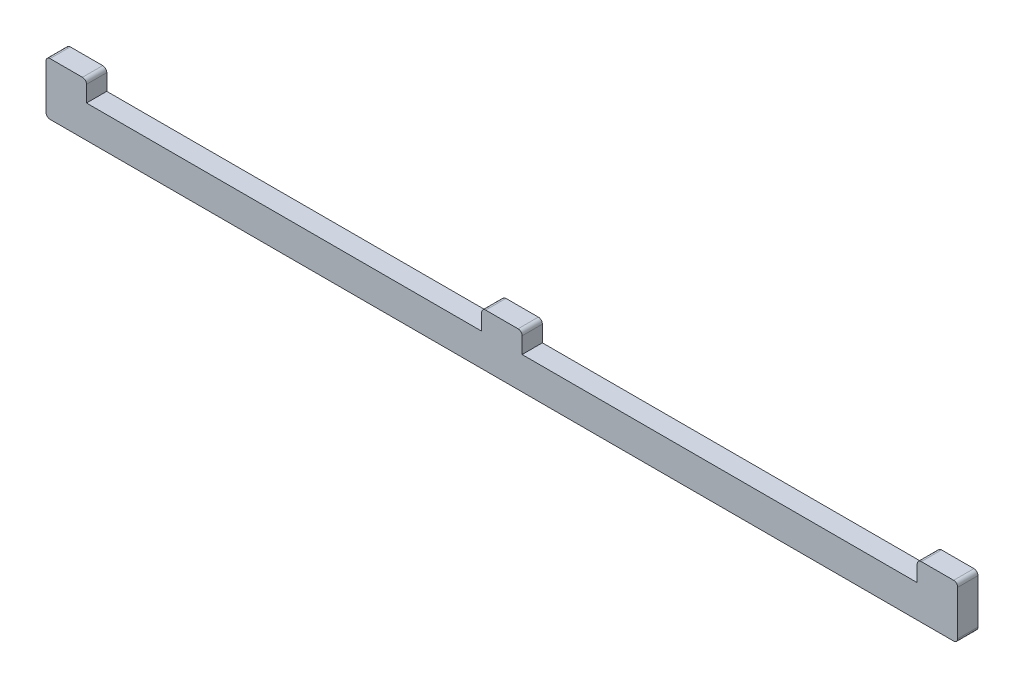
from build123d import *

# Parameters (mm, degrees)
BOSS_EXTRUDE1_DEPTH = 5


with BuildPart() as part:
    # Sketch1 → Boss-Extrude1 (new body)
    with BuildSketch(Plane.XY):
        with BuildLine():
            Line((117.5, 8), (215, 8))
            Line((215, 8), (215, 12))
            ThreePointArc((215, 12), (215.292893219, 12.707106781), (216, 13))
            Line((216, 13), (224, 13))
            ThreePointArc((224, 13), (224.707106781, 12.707106781), (225, 12))
            Line((225, 12), (225, 5))
            Line((225, 5), (225, 1))
            ThreePointArc((225, 1), (224.707106781, 0.292893219), (224, 0))
            Line((224, 0), (1, 0))
            ThreePointArc((1, 0), (0.292893219, 0.292893219), (0, 1))
            Line((0, 1), (0, 8))
            Line((0, 8), (0, 12))
            ThreePointArc((0, 12), (0.292893219, 12.707106781), (1, 13))
            Line((1, 13), (9, 13))
            ThreePointArc((9, 13), (9.707106781, 12.707106781), (10, 12))
            Line((10, 12), (10, 8))
            Line((10, 8), (107.5, 8))
            Line((107.5, 8), (107.5, 12))
            ThreePointArc((107.5, 12), (107.792893219, 12.707106781), (108.5, 13))
            Line((108.5, 13), (116.5, 13))
            ThreePointArc((116.5, 13), (117.207106781, 12.707106781), (117.5, 12))
            Line((117.5, 12), (117.5, 8))
        make_face()
    extrude(amount=BOSS_EXTRUDE1_DEPTH)


solid = part.part
